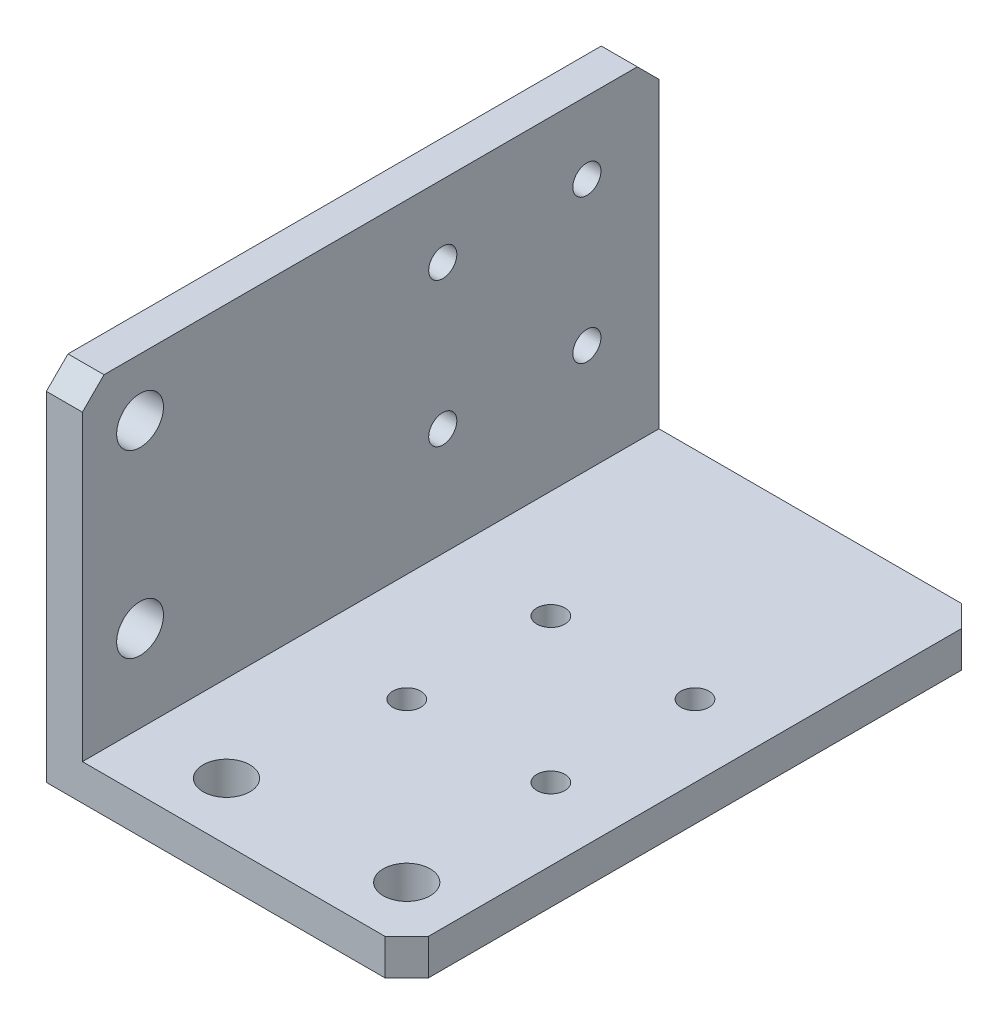
from build123d import *

# Parameters (mm, degrees)
ESTRUSIONE_ESTRUSIONE1_DEPTH = 80
FORO_6_5_6_5_1_D             = 6.5
FORO_6_5_6_5_2_D             = 6.5
FORO_6_5_6_5_2_DEPTH         = 5
FORO_6_5_6_5_2_TIP           = 1.952797012
SMUSSO1_SIZE                 = 3
M3_5_CLEARANCE_HOLE1_D       = 3.9
M3_5_CLEARANCE_HOLE2_D       = 3.9


with BuildPart() as part:
    # Schizzo1 → Estrusione-Estrusione1 (new body)
    with BuildSketch(Plane.XY):
        Polygon((0, 0), (0, 50), (5, 50), (5, 5), (50, 5), (50, 0), align=None)
    extrude(amount=ESTRUSIONE_ESTRUSIONE1_DEPTH)

    # Foro Ø6.5 (6.5)-1 (through all)
    with Locations(Plane(origin=(0, 0, 0), x_dir=(-1, 0, 0), z_dir=(0, -1, 0))):
        with Locations((-17, -72), (-42, -72)):
            Hole(FORO_6_5_6_5_1_D / 2)

    # Foro Ø6.5 (6.5)-2
    with Locations(Plane.ZY):
        with Locations((72, 42), (72, 17)):
            Hole(FORO_6_5_6_5_2_D / 2, depth=FORO_6_5_6_5_2_DEPTH)
            with Locations((0, 0, -(FORO_6_5_6_5_2_DEPTH + FORO_6_5_6_5_2_TIP / 2))):  # 118° drill point
                Cone(0, FORO_6_5_6_5_2_D / 2, FORO_6_5_6_5_2_TIP, mode=Mode.SUBTRACT)

    # Smusso1
    smusso1_edges = [part.edges().sort_by_distance(p)[0] for p in [
        (2.5, 50, 0),
        (50, 2.5, 0),
        (2.5, 50, 80),
        (50, 2.5, 80),
    ]]
    chamfer(smusso1_edges, length=SMUSSO1_SIZE)

    # M3.5 Clearance Hole1 (through all)
    with Locations(Plane(origin=(0, 40, 10), x_dir=(0, 0, -1), z_dir=(-1, 0, 0))):
        with Locations((0, 0), (-20, 0), (-20, 20), (0, 20)):
            Hole(M3_5_CLEARANCE_HOLE1_D / 2)

    # M3.5 Clearance Hole2 (through all)
    with Locations(Plane(origin=(20, 0, 50), x_dir=(-1, 0, 0), z_dir=(0, -1, 0))):
        with Locations((0, 0), (-20, 0), (-20, 20), (0, 20)):
            Hole(M3_5_CLEARANCE_HOLE2_D / 2)


solid = part.part
